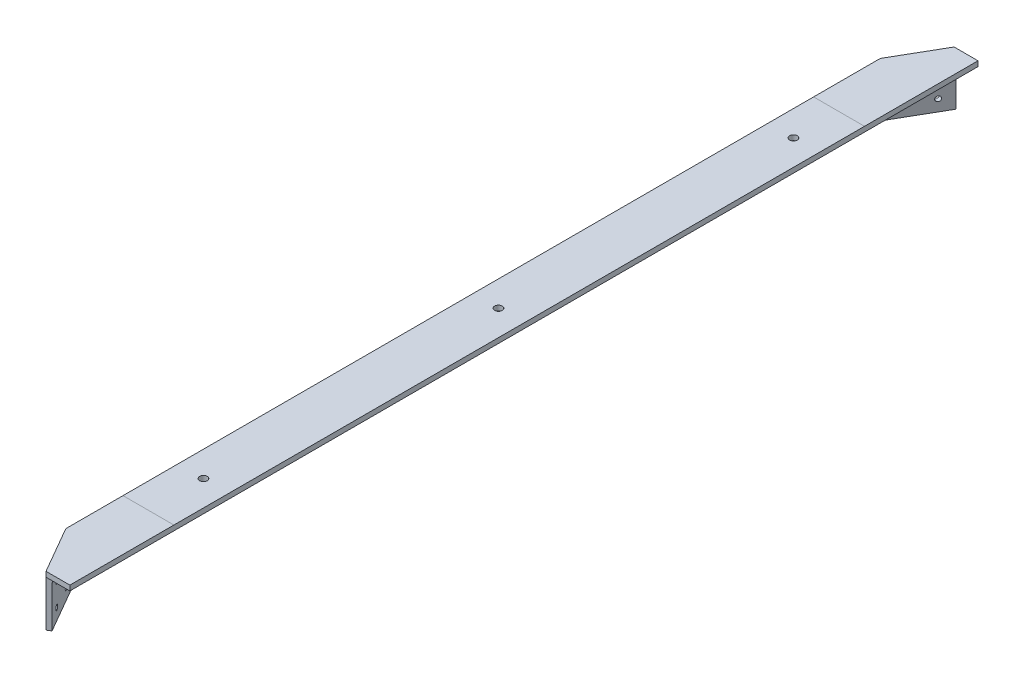
from build123d import *

# Parameters (mm, degrees)
BOSS_EXTRUDE1_DEPTH  = 640
BOSS_EXTRUDE2_DEPTH  = 8
BOSS_EXTRUDE3_DEPTH  = 72
SKETCH6_R            = 4
CUT_EXTRUDE1_DEPTH   = 8
FILLET1_R            = 10
FILLET2_R            = 8
FILLET1_OF_MIRROR1_R = 10
FILLET2_OF_MIRROR1_R = 8
SKETCH8_R            = 6
CUT_EXTRUDE2_DEPTH   = 8


with BuildPart() as part:
    # Sketch1 → Boss-Extrude1 (new body)
    with BuildSketch(Plane.XY):
        Polygon((-8, 8), (72, 8), (72, 0), (0, 0), (0, -72), (-8, -72), align=None)
    boss_extrude1 = extrude(amount=BOSS_EXTRUDE1_DEPTH)

    # Sketch3 → Boss-Extrude2 (add)
    with BuildSketch(Plane(origin=(0, 0, 0), x_dir=(1, 0, 0), z_dir=(0, 1, 0))):
        Polygon((-8, -640), (34.5, -713.612159322), (72, -713.612159322), (72, -640), align=None)
    boss_extrude2 = extrude(amount=BOSS_EXTRUDE2_DEPTH)

    # Sketch4 → Boss-Extrude3 (add)
    with BuildSketch(Plane.XZ):
        Polygon((-8, 640), (34.5, 713.612159322), (40.5, 710.148057707), (0, 640), align=None)
    boss_extrude3 = extrude(amount=BOSS_EXTRUDE3_DEPTH)

    # Sketch6 → Cut-Extrude1 (cut)
    with BuildSketch(Plane(origin=(-277.128129211, 0, 160), x_dir=(-0.4999999999999956, 0, -0.8660254037844413), z_dir=(0.8660254037844413, 0, -0.4999999999999956))):
        with Locations((-615.006258422, -18)):
            Circle(SKETCH6_R)
        with Locations((-574.506258422, -18)):
            Circle(SKETCH6_R)
        with Locations((-574.506258422, -54)):
            Circle(SKETCH6_R)
        with Locations((-615.006258422, -54)):
            Circle(SKETCH6_R)
    cut_extrude1 = extrude(amount=-CUT_EXTRUDE1_DEPTH, mode=Mode.SUBTRACT)

    # Fillet1
    fillet1_edges = [part.edges().sort_by_distance(p)[0] for p in [
        (-8, -32, 640),
        (0, -36, 640),
    ]]
    fillet(fillet1_edges, radius=FILLET1_R)

    # Fillet2
    fillet2_edges = [part.edges().sort_by_distance(p)[0] for p in [
        (0, 0, 318.660254038),
        (0.340741737, 0, 639.908698527),
        (20.919872981, 0, 676.234282891),
    ]]
    fillet(fillet2_edges, radius=FILLET2_R)

    # Mirror1: Boss-Extrude1, Boss-Extrude2, Boss-Extrude3, Cut-Extrude1 across plane
    add(boss_extrude1.mirror(Plane.XY))
    add(boss_extrude2.mirror(Plane.XY))
    add(boss_extrude3.mirror(Plane.XY))
    add(cut_extrude1.mirror(Plane.XY), mode=Mode.SUBTRACT)

    # Fillet1 of Mirror1
    fillet1_of_mirror1_edges = [part.edges().sort_by_distance(p)[0] for p in [
        (-8, -32, -640),
        (0, -36, -640),
    ]]
    fillet(fillet1_of_mirror1_edges, radius=FILLET1_OF_MIRROR1_R)

    # Fillet2 of Mirror1
    fillet2_of_mirror1_edges = [part.edges().sort_by_distance(p)[0] for p in [
        (0, 0, -318.660254038),
        (0.340741737, 0, -639.908698527),
        (20.919872981, 0, -676.234282891),
    ]]
    fillet(fillet2_of_mirror1_edges, radius=FILLET2_OF_MIRROR1_R)

    # Sketch8 → Cut-Extrude2 (cut)
    with BuildSketch(Plane(origin=(0, 8, 0), x_dir=(1, 0, 0), z_dir=(0, 1, 0))):
        with Locations((32, 463.612159322)):
            Circle(SKETCH8_R)
        with Locations((32, 0)):
            Circle(SKETCH8_R)
        with Locations((32, -463.612159322)):
            Circle(SKETCH8_R)
    extrude(amount=-CUT_EXTRUDE2_DEPTH, mode=Mode.SUBTRACT)


solid = part.part
